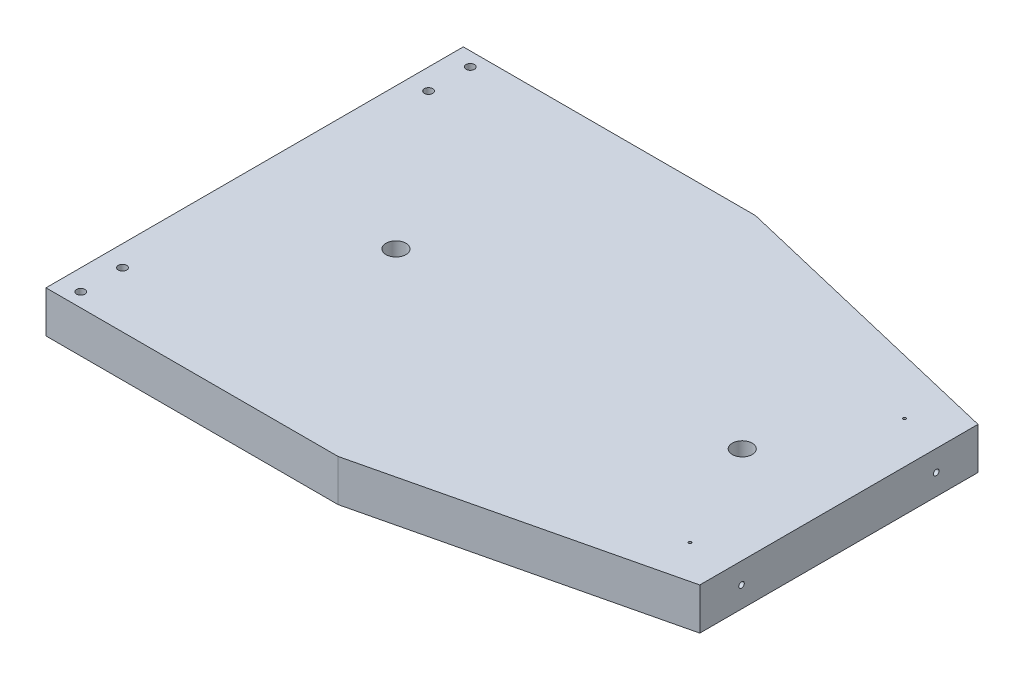
from build123d import *

# Parameters (mm, degrees)
ESBO_O1_R                = 3.571875
ESBO_O1_R_2              = 3.57
ESBO_O1_R_3              = 1.5
ESBO_O1_R_4              = 0.5
RESSALTO_EXTRUS_O1_DEPTH = 15
ESBO_O2_R                = 1
CORTE_EXTRUS_O1_DEPTH    = 10


with BuildPart() as part:
    # Esboço1 → Ressalto-extrusão1 (new body)
    with BuildSketch(Plane(origin=(0, 0, 0), x_dir=(1, 0, 0), z_dir=(0, 1, 0))):
        Polygon((210, 50), (105, 75), (0, 75), (0, -75), (105, -75), (210, -50), align=None)
        with Locations((50.8, 0)):
            Circle(ESBO_O1_R, mode=Mode.SUBTRACT)
        with Locations((175.26, 0)):
            Circle(ESBO_O1_R_2, mode=Mode.SUBTRACT)
        with Locations((7.5, -70)):
            Circle(ESBO_O1_R_3, mode=Mode.SUBTRACT)
        with Locations((7.5, -55)):
            Circle(ESBO_O1_R_3, mode=Mode.SUBTRACT)
        with Locations((7.5, 55)):
            Circle(ESBO_O1_R_3, mode=Mode.SUBTRACT)
        with Locations((7.5, 70)):
            Circle(ESBO_O1_R_3, mode=Mode.SUBTRACT)
        with Locations((195, -38.571428571)):
            Circle(ESBO_O1_R_4, mode=Mode.SUBTRACT)
        with Locations((195, 38.571428571)):
            Circle(ESBO_O1_R_4, mode=Mode.SUBTRACT)
    extrude(amount=RESSALTO_EXTRUS_O1_DEPTH)

    # Esboço2 → Corte-extrusão1 (cut)
    with BuildSketch(Plane(origin=(210, 0, 0), x_dir=(0, 0, -1), z_dir=(1, 0, 0))):
        with Locations((-35, 7.5)):
            Circle(ESBO_O2_R)
        with Locations((35, 7.5)):
            Circle(ESBO_O2_R)
    extrude(amount=-CORTE_EXTRUS_O1_DEPTH, mode=Mode.SUBTRACT)


solid = part.part
